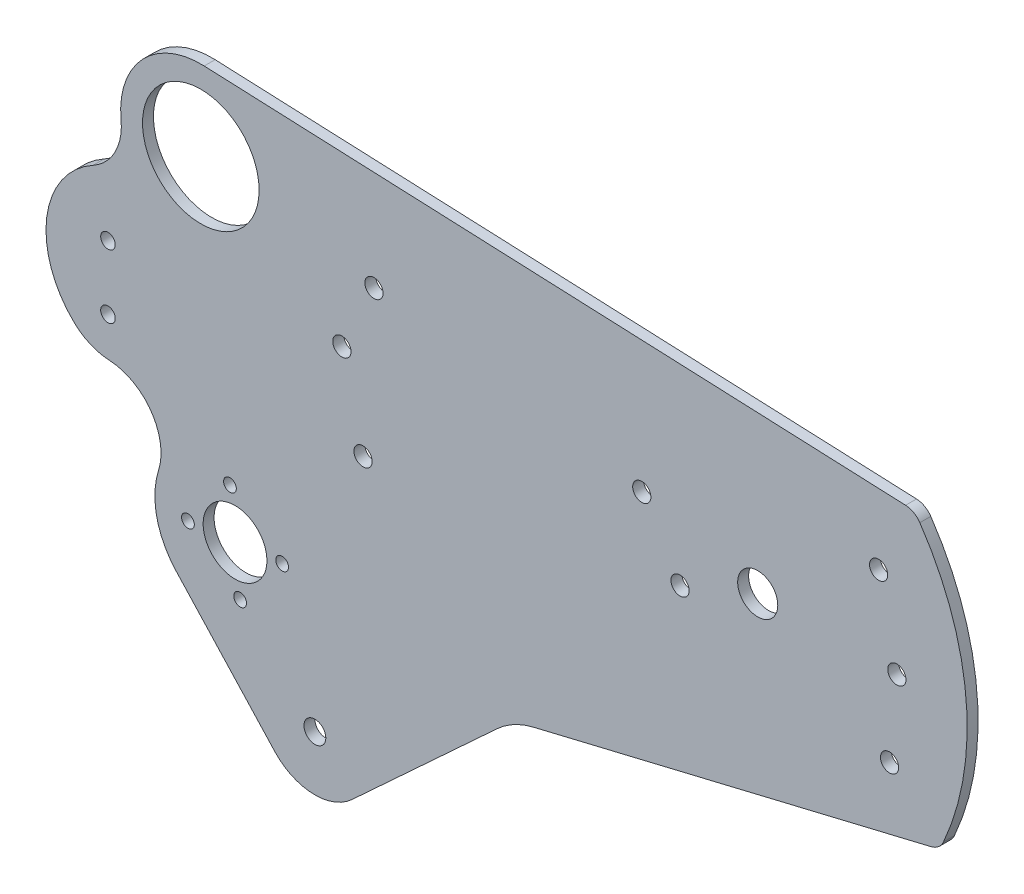
from build123d import *

# Parameters (mm, degrees)
SKETCH1_R           = 2.5
SKETCH1_R_2         = 5.5
SKETCH1_R_3         = 3
SKETCH1_R_4         = 2
SKETCH1_R_5         = 16
SKETCH1_R_6         = 1.75
SKETCH1_R_7         = 8.75
BOSS_EXTRUDE1_DEPTH = 3


with BuildPart() as part:
    # Sketch1 → Boss-Extrude1 (new body)
    with BuildSketch(Plane.XY):
        with BuildLine():
            ThreePointArc((-111.886028634, 49.480245878), (-128.824449864, 42.592956949), (-134.705774542, 25.279526249))
            ThreePointArc((-134.705774542, 25.279526249), (-136.343375771, 16.802270376), (-142.382746132, 10.632050724))
            ThreePointArc((-142.382746132, 10.632050724), (-155.099864059, -8.058287742), (-147.542861296, -29.364285714))
            ThreePointArc((-147.542861296, -29.364285714), (-143.125485566, -32.280163581), (-137.970351553, -33.480224156))
            ThreePointArc((-137.970351553, -33.480224156), (-126.431132561, -39.888203569), (-124.422839539, -52.93360637))
            ThreePointArc((-124.422839539, -52.93360637), (-124.888175134, -64.31939994), (-119.594822483, -74.410646153))
            Line((-119.594822483, -74.410646153), (-92.540517723, -103.740413224))
            ThreePointArc((-92.540517723, -103.740413224), (-82.119700521, -108.557935129), (-71.344567605, -104.595807028))
            Line((-71.344567605, -104.595807028), (-31.441449774, -67.788453323))
            ThreePointArc((-31.441449774, -67.788453323), (-26.802171393, -64.493076397), (-21.481893225, -62.473904985))
            Line((-21.481893225, -62.473904985), (87.599861039, -36.324111832))
            ThreePointArc((87.599861039, -36.324111832), (89.628937626, -35.308169791), (91, -33.5))
            ThreePointArc((91, -33.5), (97.203558128, 3.661751943), (84.51565505, 39.137054004))
            ThreePointArc((84.51565505, 39.137054004), (82.813644384, 40.69192784), (80.594954641, 41.317938046))
            Line((80.594954641, 41.317938046), (-111.886028634, 49.480245878))
        make_face()
        with Locations((76.2, -22)):
            Circle(SKETCH1_R, mode=Mode.SUBTRACT)
        with Locations((18.7, -8.7)):
            Circle(SKETCH1_R, mode=Mode.SUBTRACT)
        with Locations((8.2, 8.3)):
            Circle(SKETCH1_R, mode=Mode.SUBTRACT)
        with Locations((40.017782272, 0)):
            Circle(SKETCH1_R_2, mode=Mode.SUBTRACT)
        with Locations((78.2, -0.1)):
            Circle(SKETCH1_R, mode=Mode.SUBTRACT)
        with Locations((73.2, 22.3)):
            Circle(SKETCH1_R, mode=Mode.SUBTRACT)
        with Locations((-81.514845762, -93.570135067)):
            Circle(SKETCH1_R_3, mode=Mode.SUBTRACT)
        with Locations((-138.3, -22.75)):
            Circle(SKETCH1_R_4, mode=Mode.SUBTRACT)
        with Locations((-138.3, -5.25)):
            Circle(SKETCH1_R_4, mode=Mode.SUBTRACT)
        with Locations((-68.3, -21.5)):
            Circle(SKETCH1_R, mode=Mode.SUBTRACT)
        with Locations((-74.1, 1.7)):
            Circle(SKETCH1_R, mode=Mode.SUBTRACT)
        with Locations((-65.3, 20)):
            Circle(SKETCH1_R, mode=Mode.SUBTRACT)
        with Locations((-112.818118288, 27.5)):
            Circle(SKETCH1_R_5, mode=Mode.SUBTRACT)
        with Locations((-90.498978695, -58.098516388)):
            Circle(SKETCH1_R_6, mode=Mode.SUBTRACT)
        with Locations((-102.02811514, -72.419096433)):
            Circle(SKETCH1_R_6, mode=Mode.SUBTRACT)
        with Locations((-116.348695186, -60.889959988)):
            Circle(SKETCH1_R_6, mode=Mode.SUBTRACT)
        with Locations((-103.42383694, -59.494238188)):
            Circle(SKETCH1_R_7, mode=Mode.SUBTRACT)
        with Locations((-104.819558741, -46.569379943)):
            Circle(SKETCH1_R_6, mode=Mode.SUBTRACT)
    extrude(amount=BOSS_EXTRUDE1_DEPTH)


solid = part.part
